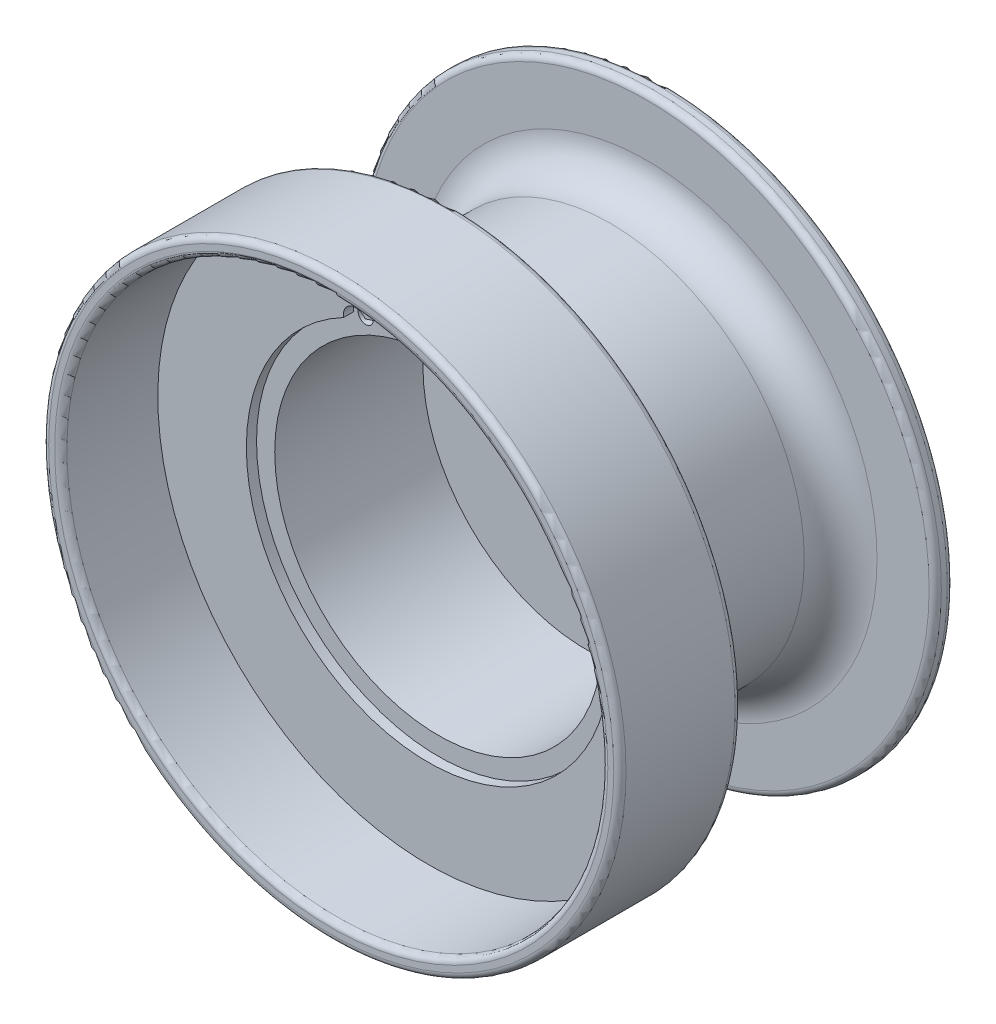
from build123d import *

# Parameters (mm, degrees)
CUT_EXTRUDE5_REACH = 125.504
SKETCH6_R          = 6.35
FILLET2_R          = 1.5875
SKETCH8_R          = 1.984375
CUT_EXTRUDE6_DEPTH = 12.7
FILLET3_R          = 1.6002
SKETCH9_R          = 3.175
CUT_EXTRUDE7_DEPTH = 123.189065469
SKETCH10_R         = 3.3734375
CUT_EXTRUDE8_DEPTH = 133.178037534


with BuildPart() as part:
    # Sketch1 → Base-Revolve (revolve)
    with BuildSketch(Plane.ZY, mode=Mode.PRIVATE) as base_revolve_sk:
        with BuildLine():
            Line((0, 31.369), (0, 75.565))
            Line((0, 75.565), (4.7625, 75.565))
            Line((4.7625, 75.565), (4.7625, 60.325))
            ThreePointArc((4.7625, 60.325), (7.552307909, 53.589807909), (14.2875, 50.8))
            Line((14.2875, 50.8), (46.0375, 50.8))
            ThreePointArc((46.0375, 50.8), (52.772692091, 53.589807909), (55.5625, 60.325))
            Line((55.5625, 60.325), (55.5625, 75.565))
            Line((55.5625, 75.565), (87.3125, 75.565))
            Line((87.3125, 75.565), (87.3125, 70.8025))
            Line((87.3125, 70.8025), (61.9125, 70.8025))
            Line((61.9125, 70.8025), (61.9125, 47.625))
            Line((61.9125, 47.625), (59.2455, 47.625))
            Line((59.2455, 47.625), (59.2455, 42.8625))
            Line((59.2455, 42.8625), (20.447, 42.8625))
            Line((20.447, 42.8625), (20.447, 6.35))
            Line((20.447, 6.35), (9.525, 6.35))
            Line((9.525, 6.35), (9.525, 31.369))
            Line((9.525, 31.369), (0, 31.369))
        make_face()
    revolve(base_revolve_sk.sketch.rotate(Axis((0, 0, -101.868198758), (0, 0, 1)), 90), axis=Axis((0, 0, -101.868198758), (0, 0, 1)))

    # Sketch6 → Cut-Extrude5 (cut, up to next)
    with BuildSketch(Plane.XY.offset(61.9125), mode=Mode.PRIVATE) as cut_extrude5_sk1:
        with Locations((0, 62.865)):
            Circle(SKETCH6_R)
    cut_extrude5_tool1 = extrude(cut_extrude5_sk1.sketch, amount=-CUT_EXTRUDE5_REACH, mode=Mode.PRIVATE) & part.part
    add(cut_extrude5_tool1.solids().sort_by_distance((0, 62.865, 61.9125))[0], mode=Mode.SUBTRACT)

    # Fillet2
    fillet2_edges = [part.edges().sort_by_distance(p)[0] for p in [
        (-1.442401613, 69.049009831, 55.5625),
        (6.184009831, 61.422598387, 55.5625),
        (-6.35, 62.865, 61.9125),
    ]]
    fillet(fillet2_edges, radius=FILLET2_R - 0.0001)  # a hair under: the kernel refuses the full size

    # Sketch8 → Cut-Extrude6 (cut)
    with BuildSketch(Plane.XY.offset(61.9125)):
        with Locations((19.05, 42.781578706)):
            Circle(SKETCH8_R)
        with Locations((-19.05, 42.781578706)):
            Circle(SKETCH8_R)
    extrude(amount=-CUT_EXTRUDE6_DEPTH, mode=Mode.SUBTRACT)

    # Fillet3
    fillet3_edges = [part.edges().sort_by_distance(p)[0] for p in [
        (75.565, 0, 4.7625),
        (75.565, 0, 0),
        (31.369, 0, 0),
        (70.8025, 0, 87.3125),
        (75.565, 0, 87.3125),
        (75.565, 0, 55.5625),
    ]]
    fillet(fillet3_edges, radius=FILLET3_R)

    # Sketch9 → Cut-Extrude7 (cut, through all)
    with BuildSketch(Plane.XY.offset(59.2455)):
        with Locations((19.05, 42.781578706)):
            Circle(SKETCH9_R)
        with Locations((-19.05, 42.781578706)):
            Circle(SKETCH9_R)
    extrude(amount=CUT_EXTRUDE7_DEPTH, mode=Mode.SUBTRACT)

    # Sketch10 → Cut-Extrude8 (cut, through all)
    with BuildSketch(Plane(origin=(0, 0, 9.525), x_dir=(-1, 0, 0), z_dir=(0, 0, -1))):
        with Locations((-25.4, 0)):
            Circle(SKETCH10_R)
    extrude(amount=-CUT_EXTRUDE8_DEPTH, mode=Mode.SUBTRACT)


solid = part.part
